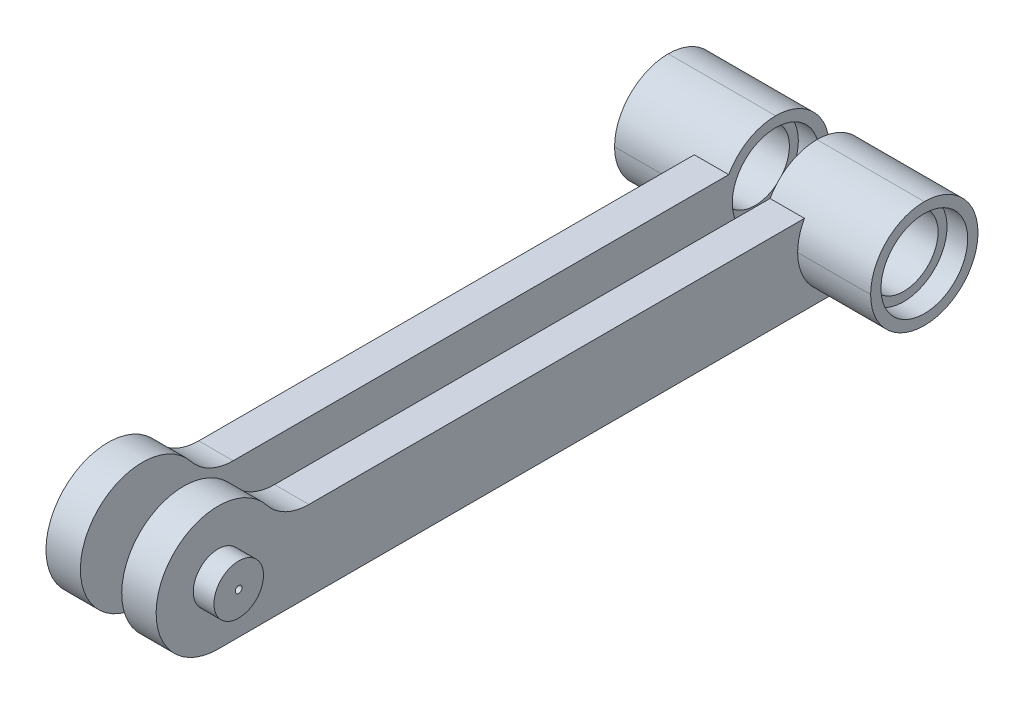
from build123d import *

# Parameters (mm, degrees)
SKETCH_1_R          = 4.5
SKETCH_1_W          = 49.9
SKETCH_1_H          = 7.8
EXTRUDE_1_DEPTH     = 2.5
EXTRUDE_START       = 2.5
SKETCH_1_6_R        = 1.8
SKETCH_1_6_R_2      = 0.25
EXTRUDE_3_DEPTH     = 1.5
SKETCH_1_5_W        = 7.8
SKETCH_1_5_H        = 7.8
EXTRUDE_2_DEPTH     = 7.8
SKETCH_1_7_R        = 2.5
CUT_EXTRUDE_1_DEPTH = 51.706015422
SKETCH_1_8_R        = 3.15
SKETCH_1_8_R_2      = 2.5
CUT_EXTRUDE_2_DEPTH = 1.5
CUT_EXTRUDE_START   = 6.3
SKETCH_1_9_R        = 3.15
SKETCH_1_9_R_2      = 2.5
CUT_EXTRUDE_3_DEPTH = 1.5
SKETCH_2_W          = 0.191868154
SKETCH_2_H          = 2
SKETCH_2_W_2        = 37.6
CUT_EXTRUDE_4_DEPTH = 51.706015422
FILLET_1_R          = 3.9


with BuildPart() as part:
    # 草图1 → 凸台-拉伸1 (new body)
    with BuildSketch(Plane(origin=(0, 0, 0), x_dir=(0, 0, -1), z_dir=(1, 0, 0))):
        Circle(SKETCH_1_R)
        with Locations((24.95, -0.6)):
            Rectangle(SKETCH_1_W, SKETCH_1_H)
    extrude(amount=EXTRUDE_1_DEPTH)

    # 草图1<6> → 凸台-拉伸3 (add)
    with BuildSketch(Plane(origin=(0, 0, 0), x_dir=(0, 0, -1), z_dir=(1, 0, 0)).offset(EXTRUDE_START)):
        Circle(SKETCH_1_6_R)
        Circle(SKETCH_1_6_R_2, mode=Mode.SUBTRACT)
    extrude(amount=EXTRUDE_3_DEPTH)

    # 草图1<5> → 凸台-拉伸2 (add)
    with BuildSketch(Plane(origin=(0, 0, 0), x_dir=(0, 0, -1), z_dir=(1, 0, 0))):
        with Locations((46, -0.6)):
            Rectangle(SKETCH_1_5_W, SKETCH_1_5_H)
    extrude(amount=EXTRUDE_2_DEPTH)

    # 草图1<7> → 切除-拉伸1 (cut, through all)
    with BuildSketch(Plane(origin=(0, 0, 0), x_dir=(0, 0, -1), z_dir=(1, 0, 0))):
        with Locations((46, -0.6)):
            Circle(SKETCH_1_7_R)
    extrude(amount=CUT_EXTRUDE_1_DEPTH, mode=Mode.SUBTRACT)

    # 草图1<8> → 切除-拉伸2 (cut)
    with BuildSketch(Plane(origin=(0, 0, 0), x_dir=(0, 0, -1), z_dir=(1, 0, 0))):
        with Locations((46, -0.6)):
            Circle(SKETCH_1_8_R)
        with Locations((46, -0.6)):
            Circle(SKETCH_1_8_R_2, mode=Mode.SUBTRACT)
    extrude(amount=CUT_EXTRUDE_2_DEPTH, mode=Mode.SUBTRACT)

    # 草图1<9> → 切除-拉伸3 (cut)
    with BuildSketch(Plane(origin=(0, 0, 0), x_dir=(0, 0, -1), z_dir=(1, 0, 0)).offset(CUT_EXTRUDE_START)):
        with Locations((46, -0.6)):
            Circle(SKETCH_1_9_R)
        with Locations((46, -0.6)):
            Circle(SKETCH_1_9_R_2, mode=Mode.SUBTRACT)
    extrude(amount=CUT_EXTRUDE_3_DEPTH, mode=Mode.SUBTRACT)

    # 草图2 → 切除-拉伸4 (cut, through all)
    with BuildSketch(Plane.ZY):
        with BuildLine():
            Line((-3.059411708, 3.3), (-4.308131846, 3.3))
            Line((-4.308131846, 3.3), (-4.308131846, 1.3))
            ThreePointArc((-4.308131846, 1.3), (-3.817089795, 2.383238447), (-3.059411708, 3.3))
        make_face()
        with Locations((-4.404065923, 2.3)):
            Rectangle(SKETCH_2_W, SKETCH_2_H)
        with Locations((-23.3, 2.3)):
            Rectangle(SKETCH_2_W_2, SKETCH_2_H)
    extrude(amount=-CUT_EXTRUDE_4_DEPTH, mode=Mode.SUBTRACT)

    # 圆角1
    fillet_1_edges = [part.edges().sort_by_distance(p)[0] for p in [
        (1.25, 1.3, -4.308131846),
    ]]
    fillet(fillet_1_edges, radius=FILLET_1_R)
    fillet_1_2_edges = [part.edges().sort_by_distance(p)[0] for p in [
        (3.9, -4.5, -49.9),
        (3.9, 3.3, -49.9),
        (5.15, -4.5, -42.1),
        (3.9, 3.3, -42.1),
    ]]
    fillet(fillet_1_2_edges, radius=FILLET_1_R - 0.0001)  # a hair under: the kernel refuses the full size


with BuildPart() as body_2:
    # 镜向1: mirrored copy
    add(part.part.mirror(Plane(origin=(-1.5, 0, 0), x_dir=(0, 0, 1), z_dir=(1, 0, 0))))


solid = Compound([part.part, body_2.part])
